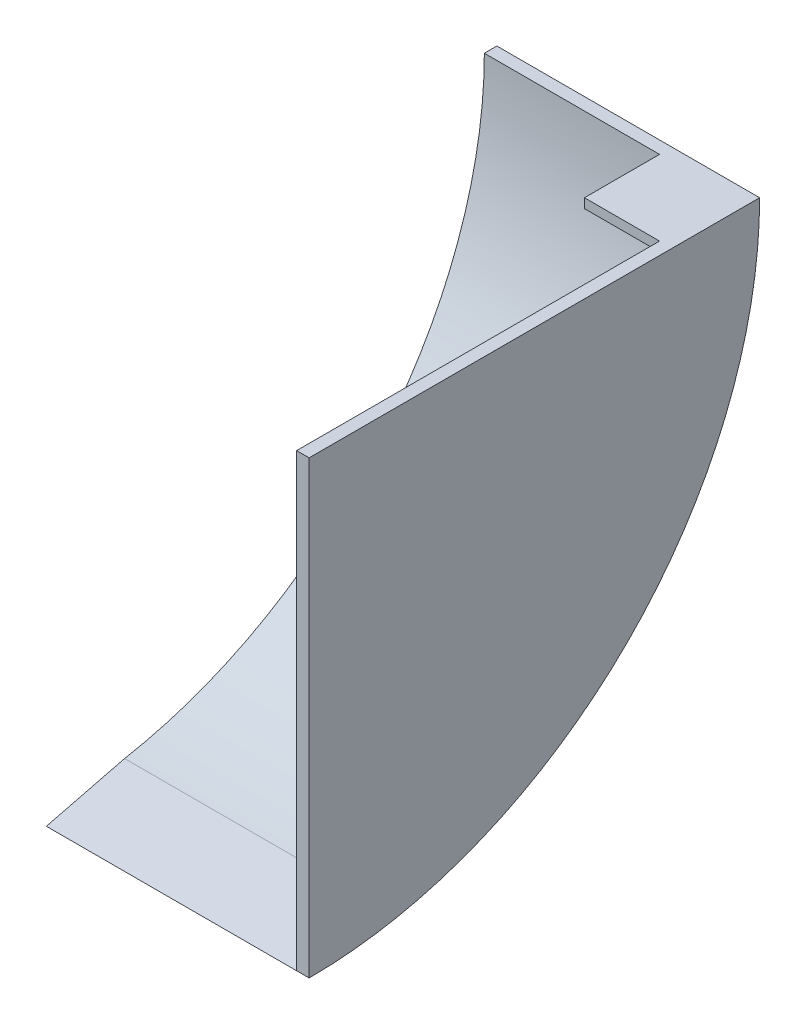
from build123d import *

# Parameters (mm, degrees)
BOSS_EXTRUDE1_DEPTH = 100
BOSS_EXTRUDE2_DEPTH = 5
CHAMFER1_SIZE       = 5
SKETCH4_W           = 30
SKETCH4_H           = 3.762328583
BOSS_EXTRUDE3_DEPTH = 30


with BuildPart() as part:
    # Sketch2 → Boss-Extrude1 (new body)
    with BuildSketch(Plane(origin=(0, 0, 0), x_dir=(0, 0, -1), z_dir=(1, 0, 0))):
        with BuildLine():
            Line((175, 0), (180, 0))
            ThreePointArc((180, 0), (127.279220614, -127.279220614), (0, -180))
            Line((0, -180), (0, -175))
            ThreePointArc((0, -175), (123.743686708, -123.743686708), (175, 0))
        make_face()
    extrude(amount=BOSS_EXTRUDE1_DEPTH)

    # Sketch3 → Boss-Extrude2 (add)
    with BuildSketch(Plane(origin=(100, 0, 0), x_dir=(0, 0, -1), z_dir=(1, 0, 0))):
        with BuildLine():
            Line((0, 0), (0, -180))
            ThreePointArc((0, -180), (127.279220614, -127.279220614), (180, 0))
            Line((180, 0), (0, 0))
        make_face()
    extrude(amount=BOSS_EXTRUDE2_DEPTH)

    # Chamfer1
    # the kernel refuses this chamfer: 20, 5 mm, written as the material it takes off along each edge
    with BuildSketch(Plane(origin=(-80.427863616, -175, 0), x_dir=(0, -1, 0), z_dir=(1, 0, 0))) as chamfer1_piece_1:
        with BuildLine():
            Line((CHAMFER1_SIZE, 0), (-2.813534961, 31.254139845))
            ThreePointArc((-2.813534961, 31.254139845), (-0.740839573, 16.085552754), (0, 0))
            Line((0, 0), (CHAMFER1_SIZE, 0))
        make_face()
    extrude(amount=180.427863616, mode=Mode.SUBTRACT)

    # Sketch4 → Boss-Extrude3 (add)
    with BuildSketch(Plane.ZY.offset(-100)):
        with Locations((-160, -1.881164292)):
            Rectangle(SKETCH4_W, SKETCH4_H)
    extrude(amount=BOSS_EXTRUDE3_DEPTH)


solid = part.part
